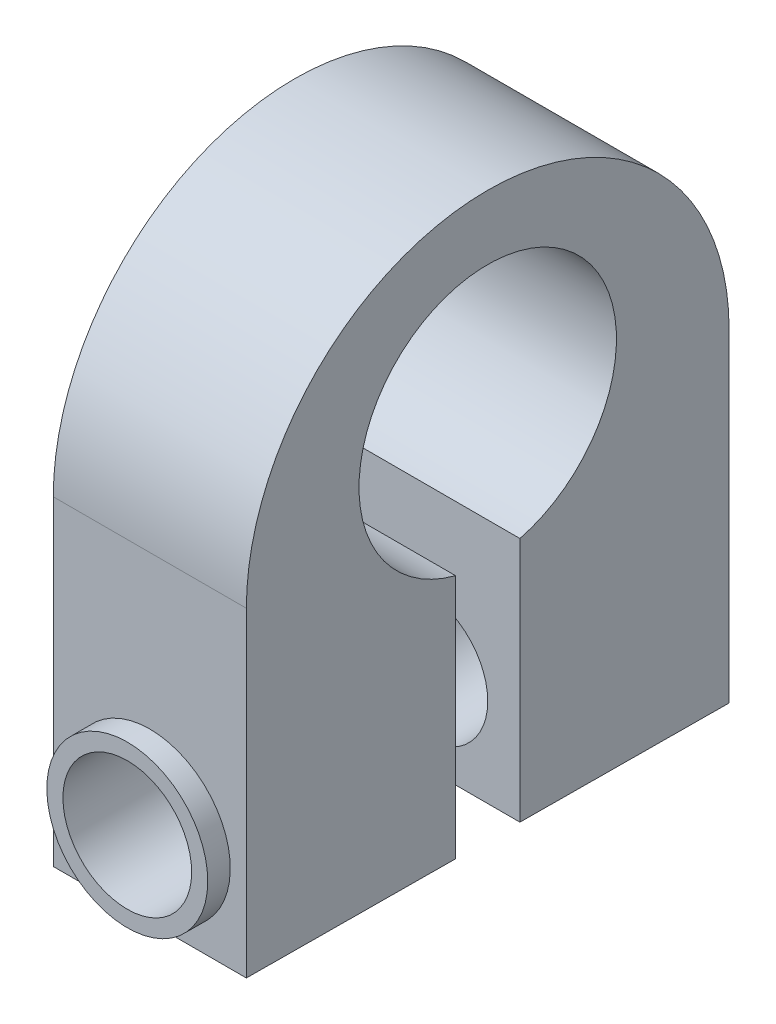
from build123d import *

# Parameters (mm, degrees)
BOSS_EXTRUDE5_DEPTH = 15
SKETCH1_R           = 10
CUT_EXTRUDE2_DEPTH  = 81
SKETCH1_7_R         = 12.5
SKETCH1_7_R_2       = 10
BOSS_EXTRUDE6_DEPTH = 81
CUT_EXTRUDE3_DEPTH  = 40.5


with BuildPart() as part:
    # Sketch2 → Boss-Extrude5 (new, symmetric)
    with BuildSketch(Plane(origin=(0, 0, 0), x_dir=(0, 0, -1), z_dir=(1, 0, 0))):
        with BuildLine():
            ThreePointArc((-20, 43.75), (-24.188611699, 31.502551286), (-35, 24.385083269))
            Line((-35, 24.385083269), (-35, -13.783333333))
            Line((-35, -13.783333333), (-2.5, -14))
            Line((-2.5, -14), (-2.5, 36.25))
            ThreePointArc((-2.5, 36.25), (-40, 73.75), (-77.5, 36.25))
            Line((-77.5, 36.25), (-77.5, -13.5))
            Line((-77.5, -13.5), (-45, -13.716666667))
            Line((-45, -13.716666667), (-45, 24.385083269))
            ThreePointArc((-45, 24.385083269), (-52.247448714, 59.561388301), (-20, 43.75))
        make_face()
    extrude(amount=BOSS_EXTRUDE5_DEPTH, both=True)

    # Sketch1 → Cut-Extrude2 (cut)
    with BuildSketch(Plane.XY):
        Circle(SKETCH1_R)
    extrude(amount=CUT_EXTRUDE2_DEPTH, mode=Mode.SUBTRACT)

    # Sketch1<7> → Boss-Extrude6 (add)
    with BuildSketch(Plane.XY):
        Circle(SKETCH1_7_R)
        Circle(SKETCH1_7_R_2, mode=Mode.SUBTRACT)
    extrude(amount=BOSS_EXTRUDE6_DEPTH)

    # Sketch2<6> → Cut-Extrude3 (cut, symmetric)
    with BuildSketch(Plane(origin=(0, 0, 0), x_dir=(0, 0, -1), z_dir=(1, 0, 0))):
        with BuildLine():
            Line((-35, -13.783333333), (-35, 24.385083269))
            ThreePointArc((-35, 24.385083269), (-40, 23.75), (-45, 24.385083269))
            Line((-45, 24.385083269), (-45, -13.716666667))
            Line((-45, -13.716666667), (-35, -13.783333333))
        make_face()
    extrude(amount=CUT_EXTRUDE3_DEPTH, both=True, mode=Mode.SUBTRACT)


solid = part.part
